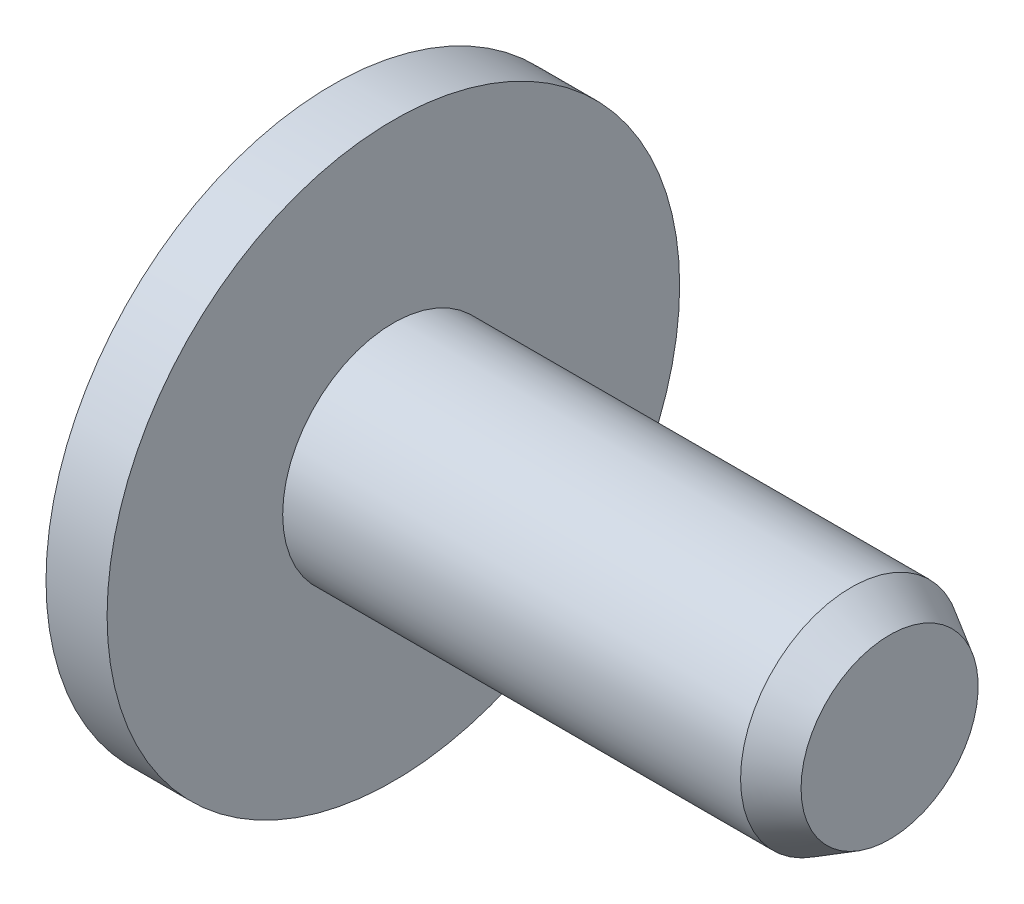
from build123d import *

# Parameters (mm, degrees)
CHAMFER1_SIZE      = 0.29
CHAMFER1_SIZE2     = 0.502294734
CUT_EXTRUDE1_DEPTH = 1.58
DRAFT1_ANGLE       = -35
DRAFT2_ANGLE       = -8
FILLET1_R          = 0.25


with BuildPart() as part:
    # Sketch1 → Revolve1 (revolve)
    with BuildSketch(Plane.XY):
        with BuildLine():
            Line((0, 3.75), (0, 1.45))
            Line((0, 1.45), (6.5, 1.45))
            Line((6.5, 1.45), (6.5, 0))
            Line((6.5, 0), (-2.35, 0))
            ThreePointArc((-2.35, 0), (-1.940427702, 1.71610023), (-0.8, 3.0622704))
            Line((-0.8, 3.0622704), (-0.8, 3.75))
            Line((-0.8, 3.75), (0, 3.75))
        make_face()
    revolve(axis=Axis((-6.478309986, 0, 0), (1, 0, 0)))

    # Chamfer1
    chamfer1_edges = [part.edges().sort_by_distance(p)[0] for p in [
        (6.5, -1.45, 0),
    ]]
    chamfer1_side = [part.faces().sort_by_distance(p)[0] for p in [
        (6.5, 0, 0),
    ]]
    chamfer(chamfer1_edges, length=CHAMFER1_SIZE, length2=CHAMFER1_SIZE2, reference=chamfer1_side[0])

    # Sketch4 → Cut-Extrude1 (cut)
    with BuildSketch(Plane(origin=(-2.35, 0, 0), x_dir=(0, 0, -1), z_dir=(1, 0, 0))):
        Polygon((0.3, 1.5), (-0.3, 1.5), (-0.3, 0.3), (-1.5, 0.3), (-1.5, -0.3), (-0.3, -0.3), (-0.3, -1.5), (0.3, -1.5), (0.3, -0.3), (1.5, -0.3), (1.5, 0.3), (0.3, 0.3), align=None)
    extrude(amount=CUT_EXTRUDE1_DEPTH, mode=Mode.SUBTRACT)

    # Draft1
    draft1_faces = [part.faces().sort_by_distance(p)[0] for p in [
        (-1.403564361, 0, -1.5),
        (-1.403564361, -1.5, 0),
        (-1.403564361, 0, 1.5),
        (-1.403564361, 1.5, 0),
    ]]
    draft(draft1_faces, Plane.YZ.offset(-2.35), DRAFT1_ANGLE)

    # Draft2
    draft2_faces = [part.faces().sort_by_distance(p)[0] for p in [
        (-1.709589538, 0.648659775, -0.3),
        (-1.709589538, 0.3, -0.648659775),
        (-1.709589538, -0.3, -0.648659775),
        (-1.709589538, -0.648659775, -0.3),
        (-1.709589538, -0.648659775, 0.3),
        (-1.709589538, -0.3, 0.648659775),
        (-1.709589538, 0.3, 0.648659775),
        (-1.709589538, 0.648659775, 0.3),
    ]]
    draft(draft2_faces, Plane.YZ.offset(-2.35), DRAFT2_ANGLE)

    # Fillet1
    fillet1_edges = [part.edges().sort_by_distance(p)[0] for p in [
        (-1.548378832, -0.187339492, -0.187339492),
        (-1.548378832, -0.187339492, 0.187339492),
        (-1.548378832, 0.187339492, 0.187339492),
        (-1.548378832, 0.187339492, -0.187339492),
    ]]
    fillet(fillet1_edges, radius=FILLET1_R)


solid = part.part
